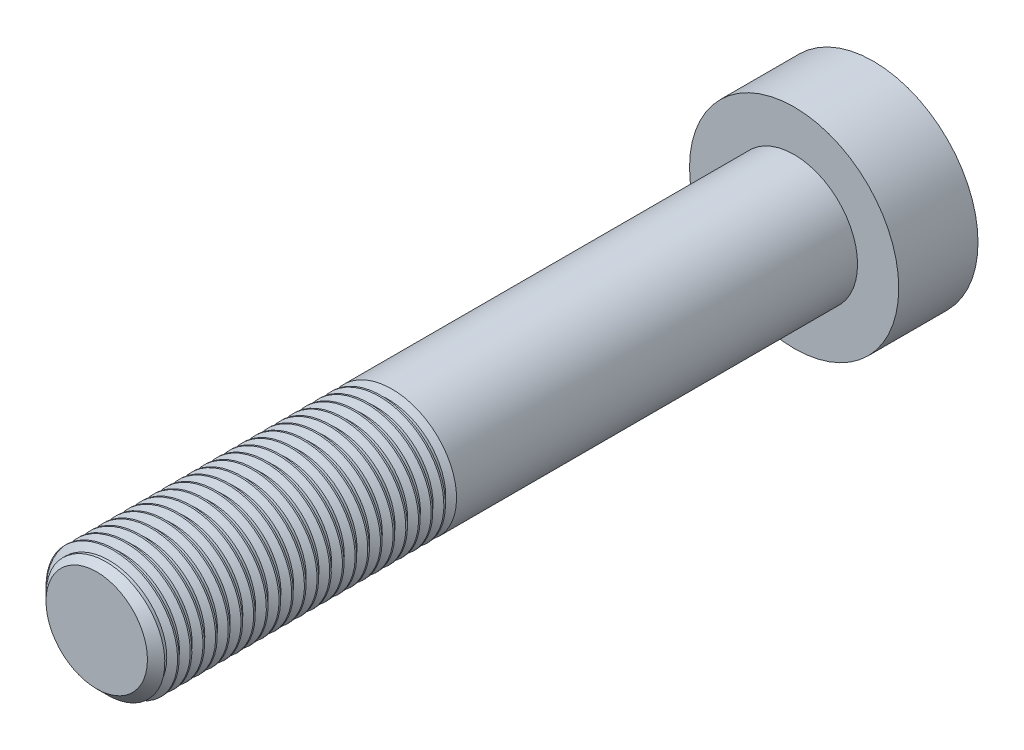
from build123d import *

# Parameters (mm, degrees)
SKETCH_1_R      = 10
EXTRUDE_1_DEPTH = 110
SKETCH_2_R      = 16.5
EXTRUDE_2_DEPTH = 12.5
CHAMFER_1_SIZE  = 2
THREAD_1_PITCH  = 2


with BuildPart() as part:
    # Sketch 1 → Бобышка-Вытянуть1 (new body)
    with BuildSketch(Plane.XY):
        Circle(SKETCH_1_R)
    extrude(amount=EXTRUDE_1_DEPTH)

    # Эскиз2 → Бобышка-Вытянуть2 (add)
    with BuildSketch(Plane(origin=(0, 0, 0), x_dir=(-1, 0, 0), z_dir=(0, 0, -1))):
        Circle(SKETCH_2_R)
    extrude(amount=EXTRUDE_2_DEPTH)

    # Фаска1
    chamfer_1_edges = [part.edges().sort_by_distance(p)[0] for p in [
        (-10, 0, 110),
    ]]
    chamfer(chamfer_1_edges, length=CHAMFER_1_SIZE)

    # Резьба1: the profile of Sketch 1 2 profile screwed along a right-hand helix of 23 turns, 10 arcs to a turn; built about Z, then put on its axis
    thread_1_z = Axis((0, 0, 0), (0, 0, 1))
    thread_1_corners = [(10.0003, 0, -0.000173205), (10.0003, 0, 1.7501732), (8.91746825, 0, 1.124999997), (8.91746825, 0, 0.624999997)]
    with BuildLine(mode=Mode.PRIVATE) as thread_1_profile:
        Line(thread_1_corners[0], thread_1_corners[1])
        Line(thread_1_corners[1], thread_1_corners[2])
        Line(thread_1_corners[2], thread_1_corners[3])
        Line(thread_1_corners[3], thread_1_corners[0])
    thread_1_cap = Face(thread_1_profile.wire())
    thread_1_turn_angles = [0, 18, 36, 54, 72, 90, 108, 126, 144, 162, 180, 198, 216, 234, 252, 270, 288, 306, 324, 342, 360]
    thread_1_turn_weights = [1, 0.9510565162951535, 1, 0.9510565162951535, 1, 0.9510565162951535, 1, 0.9510565162951535, 1, 0.9510565162951535, 1, 0.9510565162951535, 1, 0.9510565162951535, 1, 0.9510565162951535, 1, 0.9510565162951535, 1, 0.9510565162951535, 1]
    thread_1_turn_rails = [Edge.make_bspline([Vector(p[0], p[1], 0).rotate(thread_1_z, thread_1_turn_angles[k]) / thread_1_turn_weights[k] + Vector(0, 0, p[2] + THREAD_1_PITCH * thread_1_turn_angles[k] / 360) for k in range(21)], [0, 0, 0, 1, 1, 2, 2, 3, 3, 4, 4, 5, 5, 6, 6, 7, 7, 8, 8, 9, 9, 10, 10, 10], 2, thread_1_turn_weights) for p in thread_1_corners]
    thread_1_turn_sides = [Face.make_surface_from_curves(thread_1_turn_rails[p[0]], thread_1_turn_rails[p[1]]) for p in [(0, 1), (1, 2), (2, 3), (3, 0)]]
    thread_1 = Plane(origin=(0, 0, 110), x_dir=(-1, 0, 0), z_dir=(0, 0, -1)) * Solid(Shell([*[p.moved(Location((0, 0, THREAD_1_PITCH * i))) for i in range(23) for p in thread_1_turn_sides], thread_1_cap, thread_1_cap.rotate(thread_1_z, 8280).moved(Location((0, 0, THREAD_1_PITCH * 8280 / 360)))]))
    add(thread_1, mode=Mode.SUBTRACT)


solid = part.part
